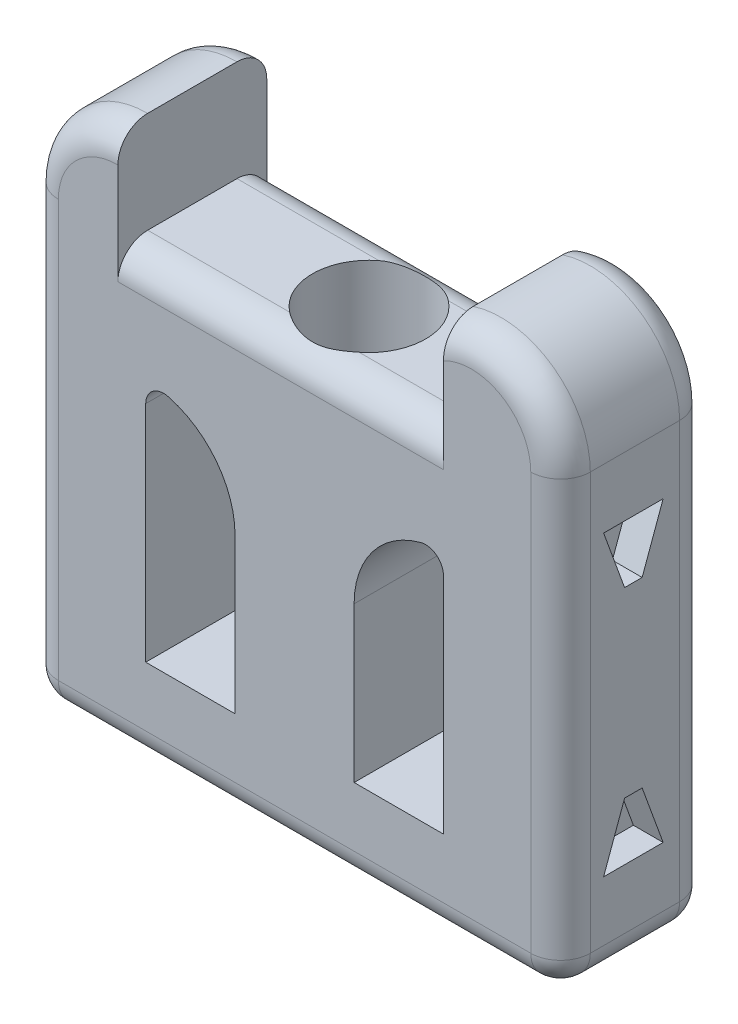
from build123d import *

# Parameters (mm, degrees)
BOSS_EXTRUDE1_DEPTH = 25
SKETCH2_R           = 9.5
CUT_EXTRUDE1_DEPTH  = 89
FILLET1_R           = 5
FILLET2_R           = 5
FILLET3_R           = 5
CUT_EXTRUDE2_DEPTH  = 5


with BuildPart() as part:
    # Sketch1 → Boss-Extrude1 (new body)
    with BuildSketch(Plane.XY):
        with BuildLine():
            Line((83.342336402, -18.001464661), (83.342336402, -93))
            Line((83.342336402, -93), (-6, -93))
            Line((-6, -93), (-6, -18.001464661))
            ThreePointArc((-6, -18.001464661), (-1.606601718, -7.394862943), (9, -3.001464661))
            Line((9, -3.001464661), (9, -20))
            Line((9, -20), (63.671168201, -20))
            Line((63.671168201, -20), (63.671168201, -3.747335869))
            ThreePointArc((63.671168201, -3.747335869), (77.143827099, -5.855117), (83.342336402, -18.001464661))
        make_face()
        with BuildLine():
            Line((63.671168201, -40.39084965), (63.671168201, -78))
            Line((63.671168201, -78), (48.671168201, -78))
            Line((48.671168201, -78), (48.671168201, -52.009969466))
            ThreePointArc((48.671168201, -52.009969466), (51.788643958, -42.855428646), (59.845250549, -37.506095703))
            Line((59.845250549, -37.506095703), (59.905984671, -37.490074897))
            ThreePointArc((59.905984671, -37.490074897), (62.502076365, -38.014344801), (63.671168201, -40.39084965))
        make_face(mode=Mode.SUBTRACT)
        with BuildLine():
            Line((28.671168201, -78), (28.671168201, -52.009969466))
            ThreePointArc((28.671168201, -52.009969466), (25.553692444, -42.855428646), (17.497085853, -37.506095703))
            Line((17.497085853, -37.506095703), (17.436351731, -37.490074897))
            ThreePointArc((17.436351731, -37.490074897), (14.840260037, -38.014344801), (13.671168201, -40.39084965))
            Line((13.671168201, -40.39084965), (13.671168201, -78))
            Line((13.671168201, -78), (28.671168201, -78))
        make_face(mode=Mode.SUBTRACT)
    extrude(amount=BOSS_EXTRUDE1_DEPTH)

    # Sketch2 → Cut-Extrude1 (cut)
    with BuildSketch(Plane.XZ.offset(93)):
        with Locations(Location((38.671168201, 12.5, 0), (0, 0, 270))):
            Circle(SKETCH2_R)
    extrude(amount=-CUT_EXTRUDE1_DEPTH, mode=Mode.SUBTRACT)

    # Fillet1
    # the kernel refuses this fillet: 5 mm, written as the material it takes off along each edge
    with BuildSketch(Plane(origin=(95.842336402, -93, 0), x_dir=(0, 1, 0), z_dir=(-1, 0, 0))) as fillet1_piece_1:
        with BuildLine():
            CenterArc((FILLET1_R, -FILLET1_R), FILLET1_R, 90, 90)
            Line((0, -FILLET1_R), (0, 0))
            Line((0, 0), (FILLET1_R, 0))
        make_face()
    extrude(amount=114.342336402, mode=Mode.SUBTRACT)
    with BuildSketch(Plane(origin=(83.342336402, -93, -12.5), x_dir=(0, 1, 0), z_dir=(0, 0, 1)), Plane(origin=(-6, -93, -12.5), x_dir=(1, 0, 0), z_dir=(0, 0, 1))) as fillet1_piece_2:
        with BuildLine():
            CenterArc((FILLET1_R, FILLET1_R), FILLET1_R, 180, 90)
            Line((0, FILLET1_R), (0, 0))
            Line((0, 0), (FILLET1_R, 0))
        make_face()
    extrude(amount=50, mode=Mode.SUBTRACT)
    with BuildSketch(Plane(origin=(95.842336402, -93, 25), x_dir=(0, 1, 0), z_dir=(-1, 0, 0))) as fillet1_piece_3:
        with BuildLine():
            CenterArc((FILLET1_R, FILLET1_R), FILLET1_R, 180, 90)
            Line((0, FILLET1_R), (0, 0))
            Line((0, 0), (FILLET1_R, 0))
        make_face()
    extrude(amount=114.342336402, mode=Mode.SUBTRACT)

    # Fillet2
    # the kernel refuses this fillet: 5 mm, written as the material it takes off along each edge
    with BuildSketch(Plane(origin=(78.342336402, -88, 20), x_dir=(0, 0, 1), z_dir=(1, 0, 0))) as fillet2_piece_1_section:
        Polygon((0, 0), (FILLET2_R * 1.02, 0), (FILLET2_R * 1.02, FILLET2_R * 1.02), (0, FILLET2_R * 1.02), align=None)
    fillet2_piece_1 = extrude(amount=FILLET2_R * 1.02, mode=Mode.PRIVATE)
    fillet2_piece_1 = fillet2_piece_1 - Plane(origin=(78.342336402, -88, 20), x_dir=(0, 0.7071067811865475, -0.7071067811865475), z_dir=(1, 0, 0)) * Sphere(FILLET2_R, mode=Mode.PRIVATE)
    add(fillet2_piece_1, mode=Mode.SUBTRACT)
    with BuildSketch(Plane(origin=(78.342336402, -88, 5), x_dir=(0, 0, -1), z_dir=(1, 0, 0))) as fillet2_piece_2_section:
        Polygon((0, 0), (FILLET2_R * 1.02, 0), (FILLET2_R * 1.02, -FILLET2_R * 1.02), (0, -FILLET2_R * 1.02), align=None)
    fillet2_piece_2 = extrude(amount=FILLET2_R * 1.02, mode=Mode.PRIVATE)
    fillet2_piece_2 = fillet2_piece_2 - Plane(origin=(78.342336402, -88, 5), x_dir=(0, 0.7071067811865475, 0.7071067811865475), z_dir=(1, 0, 0)) * Sphere(FILLET2_R, mode=Mode.PRIVATE)
    add(fillet2_piece_2, mode=Mode.SUBTRACT)
    with BuildSketch(Plane(origin=(-1, -88, 20), x_dir=(-1, 0, 0), z_dir=(0, 0, 1))) as fillet2_piece_3_section:
        Polygon((0, 0), (FILLET2_R * 1.02, 0), (FILLET2_R * 1.02, FILLET2_R * 1.02), (0, FILLET2_R * 1.02), align=None)
    fillet2_piece_3 = extrude(amount=FILLET2_R * 1.02, mode=Mode.PRIVATE)
    fillet2_piece_3 = fillet2_piece_3 - Plane(origin=(-1, -88, 20), x_dir=(0.7071067811865476, 0.7071067811865475, 0), z_dir=(0, 0, 1)) * Sphere(FILLET2_R, mode=Mode.PRIVATE)
    add(fillet2_piece_3, mode=Mode.SUBTRACT)
    with BuildSketch(Plane(origin=(-1, -88, 5), x_dir=(-1, 0, 0), z_dir=(0, 0, -1))) as fillet2_piece_4_section:
        Polygon((0, 0), (FILLET2_R * 1.02, 0), (FILLET2_R * 1.02, -FILLET2_R * 1.02), (0, -FILLET2_R * 1.02), align=None)
    fillet2_piece_4 = extrude(amount=FILLET2_R * 1.02, mode=Mode.PRIVATE)
    fillet2_piece_4 = fillet2_piece_4 - Plane(origin=(-1, -88, 5), x_dir=(0.7071067811865476, 0.7071067811865475, 0), z_dir=(0, 0, -1)) * Sphere(FILLET2_R, mode=Mode.PRIVATE)
    add(fillet2_piece_4, mode=Mode.SUBTRACT)
    with BuildSketch(Plane(origin=(68.342336402, -18.001464661, 0), x_dir=(-0.9129658100806721, 0.4080360641214722, 0), z_dir=(-0.4080360641214722, -0.9129658100806721, 0))) as fillet2_piece_5_section:
        with BuildLine():
            CenterArc((15 - FILLET2_R, -FILLET2_R), FILLET2_R, 0, 90)
            Line((15 - FILLET2_R, 0), (15 - FILLET2_R, FILLET2_R * 0.02))
            Line((15 - FILLET2_R, FILLET2_R * 0.02), (15 + FILLET2_R * 0.02, FILLET2_R * 0.02))
            Line((15 + FILLET2_R * 0.02, FILLET2_R * 0.02), (15 + FILLET2_R * 0.02, -FILLET2_R))
            Line((15 + FILLET2_R * 0.02, -FILLET2_R), (15, -FILLET2_R))
        make_face()
    fillet2_piece_5 = revolve(axis=Axis((68.342336402, -18.001464661, 0), (0, 0, -1)), revolution_arc=155.918477011, mode=Mode.PRIVATE)
    fillet2_piece_5 = split(fillet2_piece_5, bisect_by=Plane(origin=(63.671168201, -6.375046545, 1.425351683), z_dir=(1, 0, 0)), keep=Keep.TOP, mode=Mode.PRIVATE)
    add(fillet2_piece_5, mode=Mode.SUBTRACT)
    with BuildSketch(Plane(origin=(-6, -88, 0), x_dir=(1, 0, 0), z_dir=(0, 1, 0)), Plane(origin=(83.342336402, -18.001464661, 25), x_dir=(0, 0, -1), z_dir=(0, -1, 0))) as fillet2_piece_6:
        with BuildLine():
            CenterArc((FILLET2_R, -FILLET2_R), FILLET2_R, 90, 90)
            Line((0, -FILLET2_R), (-FILLET2_R * 0.02, -FILLET2_R))
            Line((-FILLET2_R * 0.02, -FILLET2_R), (-FILLET2_R * 0.02, FILLET2_R * 0.02))
            Line((-FILLET2_R * 0.02, FILLET2_R * 0.02), (FILLET2_R, FILLET2_R * 0.02))
            Line((FILLET2_R, FILLET2_R * 0.02), (FILLET2_R, 0))
        make_face()
    extrude(amount=69.998535339, mode=Mode.SUBTRACT)
    with BuildSketch(Plane(origin=(68.342336402, -18.001464661, 25), x_dir=(-0.9129658100806721, 0.4080360641214721, 0), z_dir=(-0.4080360641214721, -0.9129658100806721, 0))) as fillet2_piece_7_section:
        with BuildLine():
            CenterArc((15 - FILLET2_R, FILLET2_R), FILLET2_R, 270, 90)
            Line((15 - FILLET2_R, 0), (15 - FILLET2_R, -FILLET2_R * 0.02))
            Line((15 - FILLET2_R, -FILLET2_R * 0.02), (15 + FILLET2_R * 0.02, -FILLET2_R * 0.02))
            Line((15 + FILLET2_R * 0.02, -FILLET2_R * 0.02), (15 + FILLET2_R * 0.02, FILLET2_R))
            Line((15 + FILLET2_R * 0.02, FILLET2_R), (15, FILLET2_R))
        make_face()
    fillet2_piece_7 = revolve(axis=Axis((68.342336402, -18.001464661, 25), (0, 0, -1)), revolution_arc=155.918477011, mode=Mode.PRIVATE)
    fillet2_piece_7 = split(fillet2_piece_7, bisect_by=Plane(origin=(63.671168201, -6.375046545, 23.574648317), z_dir=(1, 0, 0)), keep=Keep.TOP, mode=Mode.PRIVATE)
    add(fillet2_piece_7, mode=Mode.SUBTRACT)
    with BuildSketch(Plane(origin=(9, -18.001464661, 25), x_dir=(-1, 0, 0), z_dir=(0, -1, 0))) as fillet2_piece_8:
        with BuildLine():
            CenterArc((15 - FILLET2_R, FILLET2_R), FILLET2_R, 270, 90)
            Line((15, FILLET2_R), (15 + FILLET2_R * 0.02, FILLET2_R))
            Line((15 + FILLET2_R * 0.02, FILLET2_R), (15 + FILLET2_R * 0.02, -FILLET2_R * 0.02))
            Line((15 + FILLET2_R * 0.02, -FILLET2_R * 0.02), (15 - FILLET2_R, -FILLET2_R * 0.02))
            Line((15 - FILLET2_R, -FILLET2_R * 0.02), (15 - FILLET2_R, 0))
        make_face()
    revolve(axis=Axis((9, -18.001464661, 25), (0, 0, -1)), revolution_arc=90, mode=Mode.SUBTRACT)
    with BuildSketch(Plane(origin=(-6, -88, 25), x_dir=(1, 0, 0), z_dir=(0, 1, 0)), Plane(origin=(83.342336402, -18.001464661, 0), x_dir=(0, 0, 1), z_dir=(0, -1, 0))) as fillet2_piece_9:
        with BuildLine():
            CenterArc((FILLET2_R, FILLET2_R), FILLET2_R, 180, 90)
            Line((0, FILLET2_R), (-FILLET2_R * 0.02, FILLET2_R))
            Line((-FILLET2_R * 0.02, FILLET2_R), (-FILLET2_R * 0.02, -FILLET2_R * 0.02))
            Line((-FILLET2_R * 0.02, -FILLET2_R * 0.02), (FILLET2_R, -FILLET2_R * 0.02))
            Line((FILLET2_R, -FILLET2_R * 0.02), (FILLET2_R, 0))
        make_face()
    extrude(amount=69.998535339, mode=Mode.SUBTRACT)
    with BuildSketch(Plane(origin=(9, -18.001464661, 0), x_dir=(-1, 0, 0), z_dir=(0, -1, 0))) as fillet2_piece_10:
        with BuildLine():
            CenterArc((15 - FILLET2_R, -FILLET2_R), FILLET2_R, 0, 90)
            Line((15, -FILLET2_R), (15 + FILLET2_R * 0.02, -FILLET2_R))
            Line((15 + FILLET2_R * 0.02, -FILLET2_R), (15 + FILLET2_R * 0.02, FILLET2_R * 0.02))
            Line((15 + FILLET2_R * 0.02, FILLET2_R * 0.02), (15 - FILLET2_R, FILLET2_R * 0.02))
            Line((15 - FILLET2_R, FILLET2_R * 0.02), (15 - FILLET2_R, 0))
        make_face()
    revolve(axis=Axis((9, -18.001464661, 0), (0, 0, -1)), revolution_arc=90, mode=Mode.SUBTRACT)

    # Fillet3
    # the kernel refuses this fillet: 5 mm, written as the material it takes off along each edge
    with BuildSketch(Plane(origin=(9, -20, 25), x_dir=(0, -1, 0), z_dir=(1, 0, 0))) as fillet3_piece_1:
        with BuildLine():
            CenterArc((FILLET3_R, FILLET3_R), FILLET3_R, 180, 90)
            Line((0, FILLET3_R), (0, 0))
            Line((0, 0), (FILLET3_R, 0))
        make_face()
    extrude(amount=54.671168201, mode=Mode.SUBTRACT)
    with BuildSketch(Plane(origin=(9, -20, 0), x_dir=(0, -1, 0), z_dir=(1, 0, 0))) as fillet3_piece_2:
        with BuildLine():
            CenterArc((FILLET3_R, -FILLET3_R), FILLET3_R, 90, 90)
            Line((0, -FILLET3_R), (0, 0))
            Line((0, 0), (FILLET3_R, 0))
        make_face()
    extrude(amount=54.671168201, mode=Mode.SUBTRACT)

    # Sketch3 → Cut-Extrude2 (cut)
    with BuildSketch(Plane(origin=(83.342336402, 0, 0), x_dir=(0, 0, -1), z_dir=(1, 0, 0))):
        Polygon((-17.768000409, -28.001464661), (-7.768000409, -28.001464661), (-11.294178767, -37.689560075), (-14.241822052, -37.689560075), align=None)
        Polygon((-11.294178767, -68.311904586), (-14.241822052, -68.311904586), (-17.768000409, -78), (-7.768000409, -78), align=None)
    cut_extrude2 = extrude(amount=-CUT_EXTRUDE2_DEPTH, mode=Mode.SUBTRACT)

    # Mirror1: Cut-Extrude2 across plane
    add(cut_extrude2.mirror(Plane(origin=(38.671168201, 0, 0), x_dir=(0, 0, 1), z_dir=(1, 0, 0))), mode=Mode.SUBTRACT)


solid = part.part
